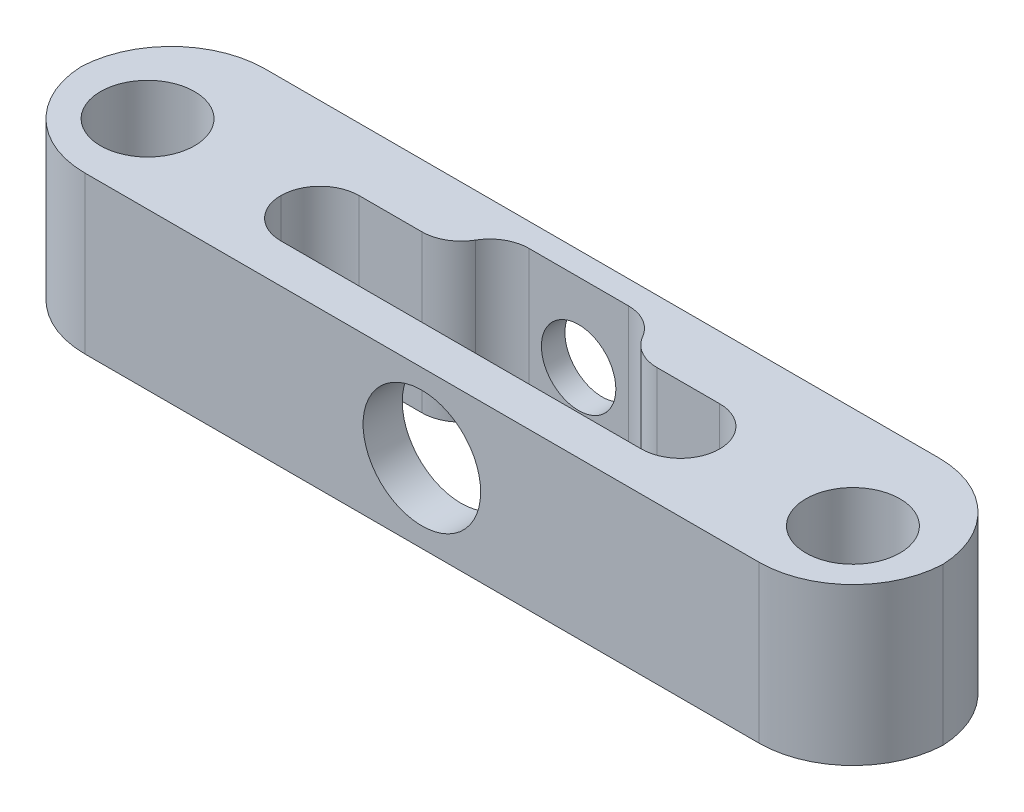
from build123d import *

# Parameters (mm, degrees)
BOSS_EXTRU_1_DEPTH      = 20
ENL_V_MAT_EXTRU_1_REACH = 63.847
ESQUISSE2_R             = 4.75
ENL_V_MAT_EXTRU_2_REACH = 64.881
ESQUISSE3_R             = 6
CONG_7_START            = -1
CONG_7_DEPTH            = 22
CONG_7_2_DEPTH          = 20
CONG_8_R                = 5
ENL_V_MAT_EXTRU_3_REACH = 64.881
ESQUISSE4_R             = 7.5
CONG_9_R                = 5
CONG_10_R               = 12


with BuildPart() as part:
    # Esquisse1 → Boss.-Extru.1 (new body)
    with BuildSketch(Plane(origin=(0, 0, 0), x_dir=(1, 0, 0), z_dir=(0, 1, 0))):
        Polygon((-30, 0), (-55, 0), (-55, 23), (55, 23), (55, 0), (25, 0), align=None)
        Polygon((28, 5), (28, 15), (10, 15), (10, 20), (-10, 20), (-10, 15), (-28, 15), (-28, 5), align=None, mode=Mode.SUBTRACT)
    extrude(amount=BOSS_EXTRU_1_DEPTH)

    # Esquisse2 → Enlèv. mat.-Extru.1 (cut, up to next)
    with BuildSketch(Plane.XY.offset(-20), mode=Mode.PRIVATE) as enl_v_mat_extru_1_sk1:
        with Locations((0, 10)):
            Circle(ESQUISSE2_R)
    enl_v_mat_extru_1_tool1 = extrude(enl_v_mat_extru_1_sk1.sketch, amount=-ENL_V_MAT_EXTRU_1_REACH, mode=Mode.PRIVATE) & part.part
    add(enl_v_mat_extru_1_tool1.solids().sort_by_distance((0, 10, -20))[0], mode=Mode.SUBTRACT)

    # Esquisse3 → Enlèv. mat.-Extru.2 (cut, up to next)
    with BuildSketch(Plane.XZ, mode=Mode.PRIVATE) as enl_v_mat_extru_2_sk1:
        with Locations(Location((45, -10, 0), (0, 0, 270))):
            Circle(ESQUISSE3_R)
    enl_v_mat_extru_2_tool1 = extrude(enl_v_mat_extru_2_sk1.sketch, amount=-ENL_V_MAT_EXTRU_2_REACH, mode=Mode.PRIVATE) & part.part
    # Esquisse3 → Enlèv. mat.-Extru.2 (cut, up to next)
    with BuildSketch(Plane.XZ, mode=Mode.PRIVATE) as enl_v_mat_extru_2_sk2:
        with Locations(Location((-45, -10, 0), (0, 0, 270))):
            Circle(ESQUISSE3_R)
    enl_v_mat_extru_2_tool2 = extrude(enl_v_mat_extru_2_sk2.sketch, amount=-ENL_V_MAT_EXTRU_2_REACH, mode=Mode.PRIVATE) & part.part
    add(enl_v_mat_extru_2_tool1.solids().sort_by_distance((45, 0, -10))[0], mode=Mode.SUBTRACT)
    add(enl_v_mat_extru_2_tool2.solids().sort_by_distance((-45, 0, -10))[0], mode=Mode.SUBTRACT)

    # Congé7: read off the stored shape, not the designer's step
    # Congé7 outline → Congé7 (cut)
    with BuildSketch(Plane(origin=(0, 0, 0), x_dir=(1, 0, 0), z_dir=(0, 1, 0)).offset(CONG_7_START)):
        with BuildLine():
            Line((-10, 15), (-10, 20))
            ThreePointArc((-10, 20), (-11.464466094, 16.464466094), (-15, 15))
            Line((-15, 15), (-10, 15))
        make_face()
        with BuildLine():
            Line((10, 15), (15, 15))
            ThreePointArc((15, 15), (11.464466094, 16.464466094), (10, 20))
            Line((10, 20), (10, 15))
        make_face()
    extrude(amount=CONG_7_DEPTH, mode=Mode.SUBTRACT)

    # Cong_7 2 outline → Cong_7 2 (add)
    with BuildSketch(Plane(origin=(0, 0, 0), x_dir=(1, 0, 0), z_dir=(0, 1, 0))):
        with BuildLine():
            ThreePointArc((-28, 10), (-26.535533906, 13.535533906), (-23, 15))
            Line((-23, 15), (-28, 15))
            Line((-28, 15), (-28, 10))
        make_face()
        with BuildLine():
            Line((28, 15), (23, 15))
            ThreePointArc((23, 15), (26.535533906, 13.535533906), (28, 10))
            Line((28, 10), (28, 15))
        make_face()
    extrude(amount=CONG_7_2_DEPTH)

    # Congé8
    cong_8_edges = [part.edges().sort_by_distance(p)[0] for p in [
        (-28, 10, -5),
        (28, 10, -5),
    ]]
    fillet(cong_8_edges, radius=CONG_8_R - 0.0001)  # a hair under: the kernel refuses the full size

    # Esquisse4 → Enlèv. mat.-Extru.3 (cut, up to next)
    with BuildSketch(Plane.XY, mode=Mode.PRIVATE) as enl_v_mat_extru_3_sk1:
        with Locations((0, 10)):
            Circle(ESQUISSE4_R)
    enl_v_mat_extru_3_tool1 = extrude(enl_v_mat_extru_3_sk1.sketch, amount=-ENL_V_MAT_EXTRU_3_REACH, mode=Mode.PRIVATE) & part.part
    add(enl_v_mat_extru_3_tool1.solids().sort_by_distance((0, 10, 0))[0], mode=Mode.SUBTRACT)

    # Congé9
    cong_9_edges = [part.edges().sort_by_distance(p)[0] for p in [
        (10, 10, -20),
        (-10, 10, -20),
    ]]
    fillet(cong_9_edges, radius=CONG_9_R)

    # Congé10
    # the kernel refuses this fillet: 12 mm, written as the material it takes off along each edge
    with BuildSketch(Plane(origin=(55, -30, -23), x_dir=(-1, 0, 0), z_dir=(0, 1, 0)), Plane(origin=(-55, -30, -23), x_dir=(0, 0, 1), z_dir=(0, 1, 0)), Plane(origin=(-55, -30, 0), x_dir=(1, 0, 0), z_dir=(0, 1, 0))) as cong_10_piece_1:
        with BuildLine():
            CenterArc((CONG_10_R, CONG_10_R), CONG_10_R, 180, 90)
            Line((0, CONG_10_R), (0, 0))
            Line((0, 0), (CONG_10_R, 0))
        make_face()
    extrude(amount=80, mode=Mode.SUBTRACT)
    with BuildSketch(Plane(origin=(55, -30, 0), x_dir=(-1, 0, 0), z_dir=(0, 1, 0))) as cong_10_piece_2:
        with BuildLine():
            CenterArc((CONG_10_R, -CONG_10_R), CONG_10_R, 90, 90)
            Line((0, -CONG_10_R), (0, 0))
            Line((0, 0), (CONG_10_R, 0))
        make_face()
    extrude(amount=80, mode=Mode.SUBTRACT)


solid = part.part
